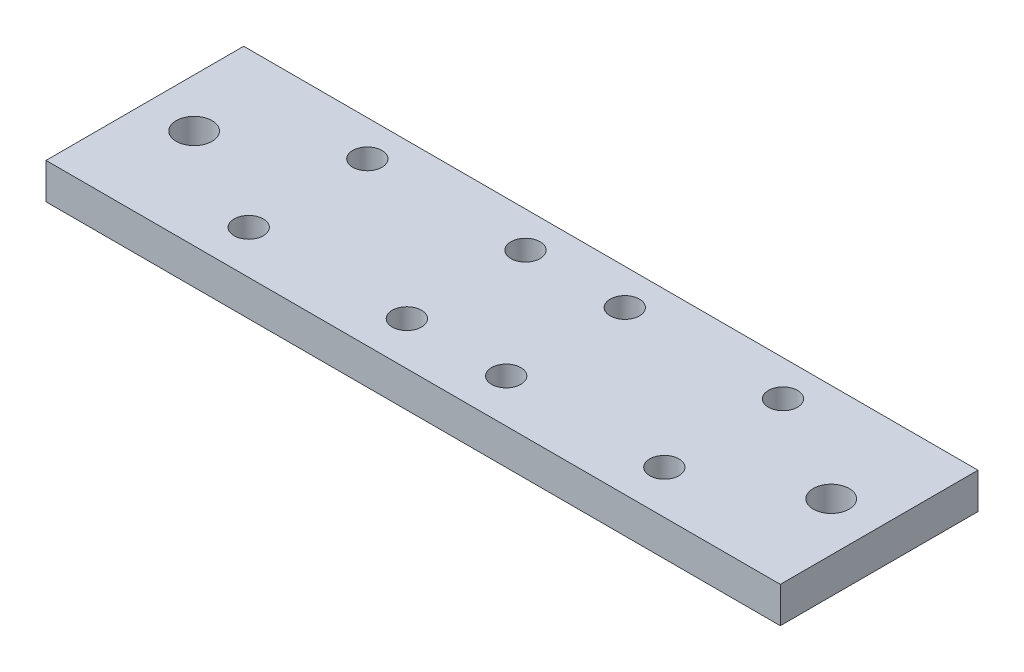
from build123d import *

# Parameters (mm, degrees)
SKETCH1_W           = 130
SKETCH1_H           = 35
BOSS_EXTRUDE1_DEPTH = 6.35
SKETCH5_R           = 3.18
CUT_EXTRUDE2_DEPTH  = 135.778790987
SKETCH8_R           = 2.58660254
CUT_EXTRUDE4_DEPTH  = 135.778790987


with BuildPart() as part:
    # Sketch1 → Boss-Extrude1 (new body)
    with BuildSketch(Plane(origin=(0, 0, 0), x_dir=(1, 0, 0), z_dir=(0, 1, 0))):
        with Locations((65, -17.5)):
            Rectangle(SKETCH1_W, SKETCH1_H)
    extrude(amount=BOSS_EXTRUDE1_DEPTH)

    # Sketch5 → Cut-Extrude2 (cut, through all)
    with BuildSketch(Plane(origin=(0, 6.35, 0), x_dir=(1, 0, 0), z_dir=(0, 1, 0))):
        with Locations((8.605, -17.382603272)):
            Circle(SKETCH5_R)
        with Locations((121.395, -17.382603272)):
            Circle(SKETCH5_R)
    extrude(amount=-CUT_EXTRUDE2_DEPTH, mode=Mode.SUBTRACT)

    # Sketch8 → Cut-Extrude4 (cut, through all)
    with BuildSketch(Plane.XZ):
        with Locations((28.208920558, 6.320355819)):
            Circle(SKETCH8_R)
        with Locations((28.208920558, 27.320355819)):
            Circle(SKETCH8_R)
        with Locations((56.208920558, 27.320355819)):
            Circle(SKETCH8_R)
        with Locations((56.208920558, 6.320355819)):
            Circle(SKETCH8_R)
        with Locations((73.790872685, 6.320355819)):
            Circle(SKETCH8_R)
        with Locations((73.790872685, 27.320355819)):
            Circle(SKETCH8_R)
        with Locations((101.790872685, 6.320355819)):
            Circle(SKETCH8_R)
        with Locations((101.790872685, 27.320355819)):
            Circle(SKETCH8_R)
    extrude(amount=-CUT_EXTRUDE4_DEPTH, mode=Mode.SUBTRACT)


solid = part.part
